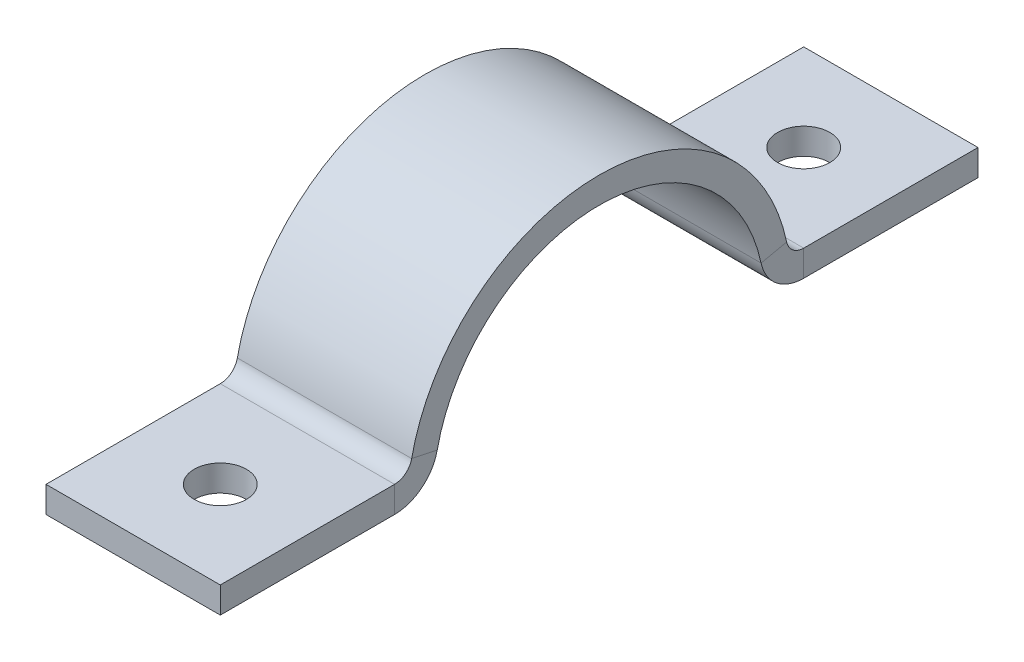
from build123d import *

# Parameters (mm, degrees)
SKETCH8_W          = 20
SKETCH8_H          = 3
SKETCH10_R         = 3
CUT_EXTRUDE1_DEPTH = 50.738672756


with BuildPart() as part:
    # Sweep1: sweep along a path in Sketch7
    with BuildLine(Plane(origin=(0, 0, 0), x_dir=(0, 0, -1), z_dir=(1, 0, 0))) as sweep1_path:
        Line((43.473389189, 0), (23.473389189, 0))
        ThreePointArc((23.473389189, 0), (20.327624841, 1.113592061), (18.583099774, 3.958333333))
        ThreePointArc((18.583099774, 3.958333333), (0, 19), (-18.583099774, 3.958333333))
        ThreePointArc((-18.583099774, 3.958333333), (-20.327624841, 1.113592061), (-23.473389189, 0))
        Line((-23.473389189, 0), (-43.473389189, 0))
    # Sketch8 → Sweep1 (sweep)
    with BuildSketch(Plane.XY.offset(-43.473389189)):
        with Locations((0, 1.5)):
            Rectangle(SKETCH8_W, SKETCH8_H)
    sweep(path=sweep1_path.line)

    # Sketch10 → Cut-Extrude1 (cut, through all)
    with BuildSketch(Plane(origin=(0, 0, 0), x_dir=(-1, 0, 0), z_dir=(0, -1, 0))):
        with Locations((0, 33.473389189)):
            Circle(SKETCH10_R)
        with Locations((0, -33.473389189)):
            Circle(SKETCH10_R)
    extrude(amount=-CUT_EXTRUDE1_DEPTH, mode=Mode.SUBTRACT)


solid = part.part
